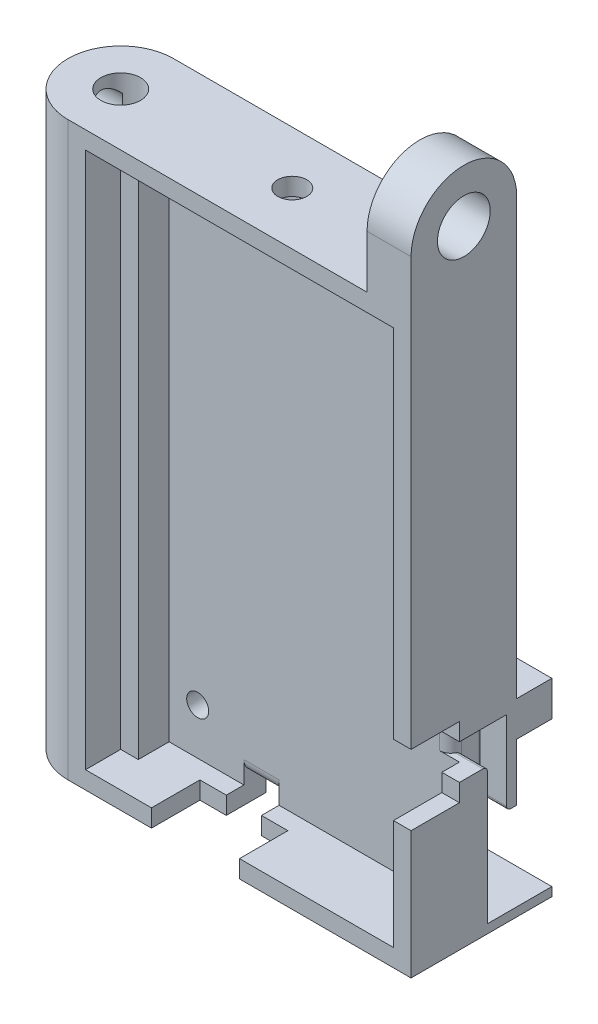
from build123d import *

# Parameters (mm, degrees)
SKETCH1_W                = 39
SKETCH1_H                = 65
BASE_DEPTH               = 4.5
SKETCH2_W                = 4
SKETCH2_H                = 57
WALLS_DEPTH              = 7.5
SKETCH3_W                = 10
SKETCH3_H                = 7.5
PWR_CONNECTOR_HOLE_DEPTH = 4
SKETCH4_W                = 7.5
SKETCH4_H                = 8
GPS_CONNECTOR_HOLE_DEPTH = 4
SKETCH5_R                = 1.25
MOUNTING_HOLES_DEPTH     = 4
GPS_MOUNT_DEPTH          = 4
SKETCH11_W               = 17
SKETCH11_H               = 1
SKETCH11_W_2             = 12
SKETCH11_H_2             = 3
PWR_CABLE_HOLDER1_DEPTH  = 4
SKETCH12_W               = 4
SKETCH12_H               = 2.5
PWR_CABLE_HOLDER2_DEPTH  = 3
PWR_FILLET_R             = 1.5
PWR_FILLET2_R            = 1
PWR_FILLET3_R            = 0.5
GPS_CABLE_HOLDER_DEPTH   = 3
GPS_START                = 1
GPS_FILLET_DEPTH         = 10
GPS_START_2              = 16.5
GPS_FILLET_2_DEPTH       = 4
GPS_START_3              = 9.15727
GPS_FILLET_3_DEPTH       = 8.34273
GPS_FILLET2_R            = 0.5
SKETCH15_R               = 6
BALLON_MOUNT_DEPTH       = 65
SKETCH16_R               = 2.25
BALLOON_MOUNT_HOLE_DEPTH = 65
SKETCH21_R               = 2.25
SAFETY_MOUNT_DEPTH       = 4.5
SKETCH22_W               = 35
SKETCH22_H               = 61
LID_HOLE_DEPTH           = 7.5
SKETCH25_W               = 3.5
SKETCH25_H               = 61
CORRECTION_DEPTH         = 2
SKETCH28_W               = 2
SKETCH28_H               = 2
SKETCH28_W_2             = 3
SMALL_WALLS_DEPTH        = 2
ANTENNA_MOUNTING_DEPTH   = 5
SKETCH30_R               = 3
ANTENNA_HOLE_DEPTH       = 5
SKETCH31_R               = 1.65
CABLE_HOLE_DEPTH         = 2


with BuildPart() as part:
    # Sketch1 → Base (new body)
    with BuildSketch(Plane.XY):
        with Locations((19.5, 32.5)):
            Rectangle(SKETCH1_W, SKETCH1_H)
    extrude(amount=BASE_DEPTH)

    # Sketch2 → Walls (add)
    with BuildSketch(Plane.XY.offset(4.5)):
        Polygon((39, 61), (39, 65), (0, 65), (0, 61), (4, 61), (35, 61), align=None)
        with Locations((37, 32.5)):
            Rectangle(SKETCH2_W, SKETCH2_H)
        Polygon((4, 61), (0, 61), (0, 0), (4, 0), (4, 4), align=None)
        Polygon((39, 0), (39, 4), (35, 4), (4, 4), (4, 0), align=None)
    extrude(amount=WALLS_DEPTH)

    # Sketch3 → PWR connector hole (cut)
    with BuildSketch(Plane(origin=(0, 4, 0), x_dir=(1, 0, 0), z_dir=(0, 1, 0))):
        with Locations((14.5, -8.25)):
            Rectangle(SKETCH3_W, SKETCH3_H)
    extrude(amount=-PWR_CONNECTOR_HOLE_DEPTH, mode=Mode.SUBTRACT)

    # Sketch4 → GPS connector hole (cut)
    with BuildSketch(Plane.ZY.offset(-35)):
        with Locations((8.25, 18.5)):
            Rectangle(SKETCH4_W, SKETCH4_H)
    extrude(amount=-GPS_CONNECTOR_HOLE_DEPTH, mode=Mode.SUBTRACT)

    # Sketch5 → Mounting holes (cut)
    with BuildSketch(Plane.XY.offset(4.5)):
        with Locations((7.25, 7.25)):
            Circle(SKETCH5_R)
        with Locations(Location((31.75, 7.25, 0), (0, 0, 180))):
            Circle(SKETCH5_R)
        with Locations(Location((7.25, 57.75, 0), (0, 0, 180))):
            Circle(SKETCH5_R)
        with Locations((31.75, 57.75)):
            Circle(SKETCH5_R)
    extrude(amount=-MOUNTING_HOLES_DEPTH, mode=Mode.SUBTRACT)

    # Sketch7 → GPS mount (add)
    with BuildSketch(Plane(origin=(0, 0, 0), x_dir=(-1, 0, 0), z_dir=(0, 0, -1))):
        Polygon((-39, 1), (-39, 0), (-7, 0), (-7, 18.5), (-39, 18.5), (-39, 17.5), (-8, 17.5), (-8, 1), align=None)
    extrude(amount=GPS_MOUNT_DEPTH)

    # Sketch11 → PWR cable holder1 (add)
    with BuildSketch(Plane(origin=(0, 0, 0), x_dir=(-1, 0, 0), z_dir=(0, 0, -1))):
        Polygon((-5, 0), (-4, 0), (-4, 21.5), (-5, 21.5), (-5, 20.5), align=None)
        with Locations((-13.5, 21)):
            Rectangle(SKETCH11_W, SKETCH11_H)
        with Locations((-33, 20)):
            Rectangle(SKETCH11_W_2, SKETCH11_H_2)
    extrude(amount=PWR_CABLE_HOLDER1_DEPTH)

    # Sketch12 → PWR cable holder2 (cut)
    with BuildSketch(Plane.XZ):
        Polygon((5, 2), (5, 0), (7, 0), (16.5, 0), (16.5, 2), (12.5, 2), align=None)
        with Locations((14.5, 3.25)):
            Rectangle(SKETCH12_W, SKETCH12_H)
    extrude(amount=-PWR_CABLE_HOLDER2_DEPTH, mode=Mode.SUBTRACT)

    # PWR fillet
    pwr_fillet_edges = [part.edges().sort_by_distance(p)[0] for p in [
        (6, 3, 0),
        (14.5, 3, 4.5),
    ]]
    fillet(pwr_fillet_edges, radius=PWR_FILLET_R)

    # PWR fillet2
    pwr_fillet2_edges = [part.edges().sort_by_distance(p)[0] for p in [
        (27, 21.5, -2),
    ]]
    fillet(pwr_fillet2_edges, radius=PWR_FILLET2_R)

    # PWR fillet3
    pwr_fillet3_edges = [part.edges().sort_by_distance(p)[0] for p in [
        (22, 21.5, -2),
        (22, 20.5, -2),
    ]]
    fillet(pwr_fillet3_edges, radius=PWR_FILLET3_R - 0.0001)  # a hair under: the kernel refuses the full size

    # Sketch13 → GPS cable holder (cut)
    with BuildSketch(Plane(origin=(39, 0, 0), x_dir=(0, 0, -1), z_dir=(1, 0, 0))):
        Polygon((-1.156586719, 11), (-2.326586719, 11), (-2.326586719, 1), (0, 1), (0, 11), align=None)
        Polygon((-2.326586719, 11), (-2.326586719, 16.5), (-3.326586719, 16.5), (-3.326586719, 1), (-2.326586719, 1), align=None)
        Polygon((-1.156586719, 20.5), (-2.326586719, 20.5), (-2.326586719, 16.5), (-2.326586719, 11), (-1.156586719, 11), align=None)
        Polygon((-2.326586719, 20.5), (-4.5, 20.5), (-4.5, 16.5), (-3.326586719, 16.5), (-2.326586719, 16.5), align=None)
    extrude(amount=-GPS_CABLE_HOLDER_DEPTH, mode=Mode.SUBTRACT)

    # GPS fillet: read off the stored shape, not the designer's step
    # GPS fillet outline → GPS fillet (cut)
    with BuildSketch(Plane(origin=(0, 0, 0), x_dir=(1, 0, 0), z_dir=(0, 1, 0)).offset(GPS_START)):
        with BuildLine():
            Line((36, -3.326586719), (36, -3.25))
            ThreePointArc((36, -3.25), (35.999412758, -3.288311358), (35.997651584, -3.326586719))
            Line((35.997651584, -3.326586719), (36, -3.326586719))
        make_face()
        with BuildLine():
            Line((36, -1.25), (36, 0))
            Line((36, 0), (34.75, 0))
            ThreePointArc((34.75, 0), (35.633883476, -0.366116524), (36, -1.25))
        make_face()
    extrude(amount=GPS_FILLET_DEPTH, mode=Mode.SUBTRACT)

    # GPS fillet 2 outline → GPS fillet 2 (cut)
    with BuildSketch(Plane(origin=(0, 0, 0), x_dir=(1, 0, 0), z_dir=(0, 1, 0)).offset(GPS_START_2)):
        with BuildLine():
            ThreePointArc((36, -3.25), (35.633883476, -4.133883476), (34.75, -4.5))
            Line((34.75, -4.5), (36, -4.5))
            Line((36, -4.5), (36, -3.25))
        make_face()
        with BuildLine():
            ThreePointArc((35.996504697, -1.156586719), (35.999125868, -1.203260674), (36, -1.25))
            Line((36, -1.25), (36, -1.156586719))
            Line((36, -1.156586719), (35.996504697, -1.156586719))
        make_face()
    extrude(amount=GPS_FILLET_2_DEPTH, mode=Mode.SUBTRACT)

    # GPS fillet 3 outline → GPS fillet 3 (cut)
    with BuildSketch(Plane(origin=(0, 0, 0), x_dir=(1, 0, 0), z_dir=(0, 1, 0)).offset(GPS_START_3)):
        with BuildLine():
            Line((36, -3.326586719), (36, -3.25))
            ThreePointArc((36, -3.25), (35.999412758, -3.288311358), (35.997651584, -3.326586719))
            Line((35.997651584, -3.326586719), (36, -3.326586719))
        make_face()
        with BuildLine():
            ThreePointArc((35.996504697, -1.156586719), (35.999125868, -1.203260674), (36, -1.25))
            Line((36, -1.25), (36, -1.156586719))
            Line((36, -1.156586719), (35.996504697, -1.156586719))
        make_face()
    extrude(amount=GPS_FILLET_3_DEPTH, mode=Mode.SUBTRACT)

    # GPS fillet2
    # the kernel refuses this fillet: 0.5 mm, written as the material it takes off along each edge
    with BuildSketch(Plane(origin=(40.25, 11, 1.156586719), x_dir=(0, 0, -1), z_dir=(-1, 0, 0))) as gps_fillet2_piece_1:
        with BuildLine():
            CenterArc((GPS_FILLET2_R, -GPS_FILLET2_R), GPS_FILLET2_R, 90, 90)
            Line((0, -GPS_FILLET2_R), (0, 0))
            Line((0, 0), (GPS_FILLET2_R, 0))
        make_face()
    extrude(amount=4.25, mode=Mode.SUBTRACT)
    with BuildSketch(Plane(origin=(40.25, 16.5, 3.326586719), x_dir=(0, -1, 0), z_dir=(-1, 0, 0))) as gps_fillet2_piece_2:
        with BuildLine():
            CenterArc((GPS_FILLET2_R, GPS_FILLET2_R), GPS_FILLET2_R, 180, 90)
            Line((0, GPS_FILLET2_R), (0, 0))
            Line((0, 0), (GPS_FILLET2_R, 0))
        make_face()
    extrude(amount=4.25, mode=Mode.SUBTRACT)
    with BuildSketch(Plane(origin=(36, 16.5, 3.326586719), x_dir=(0, -1.0, 5.126796764898245e-10), z_dir=(-1, 0, 0))) as gps_fillet2_piece_3_section:
        with BuildLine():
            CenterArc((GPS_FILLET2_R, GPS_FILLET2_R), GPS_FILLET2_R, 179.999999971, 90)
            Line((GPS_FILLET2_R * 5.12679676753e-10, GPS_FILLET2_R), (0, 0))
            Line((0, 0), (GPS_FILLET2_R, 0))
        make_face()
    gps_fillet2_piece_3 = extrude(amount=1.252348417, mode=Mode.PRIVATE)
    gps_fillet2_piece_3 = gps_fillet2_piece_3 - Plane(origin=(34.749999755, 16.5, 3.249999996), x_dir=(1.0, 0, 2.949740140725451e-09), z_dir=(0, -1, 0)) * Cylinder(1.250000245, 5, mode=Mode.PRIVATE)
    add(gps_fillet2_piece_3, mode=Mode.SUBTRACT)
    with BuildSketch(Plane(origin=(34.746504697, 11, 1.156586719), x_dir=(0, 0, -1), z_dir=(1, 0, 0))) as gps_fillet2_piece_4_section:
        with BuildLine():
            CenterArc((GPS_FILLET2_R, GPS_FILLET2_R), GPS_FILLET2_R, 180, 90)
            Line((-GPS_FILLET2_R * 5.12674791509e-10, GPS_FILLET2_R), (0, 0))
            Line((0, 0), (GPS_FILLET2_R, 0))
        make_face()
    gps_fillet2_piece_4 = extrude(amount=1.253495303, mode=Mode.PRIVATE)
    gps_fillet2_piece_4 = gps_fillet2_piece_4 - Plane(origin=(34.749999998, 11, 1.250000002), x_dir=(1.3197563913171698e-09, 0, -1.0), z_dir=(0, -1, 0)) * Cylinder(1.250000002, 5, mode=Mode.PRIVATE)
    add(gps_fillet2_piece_4, mode=Mode.SUBTRACT)

    # Sketch15 → Ballon mount (add)
    with BuildSketch(Plane.XZ):
        with Locations((0, 6)):
            Circle(SKETCH15_R)
    extrude(amount=-BALLON_MOUNT_DEPTH)

    # Sketch16 → Balloon mount hole (cut)
    with BuildSketch(Plane.XZ):
        with Locations(Location((0, 6, 0), (0, 0, 270))):
            Circle(SKETCH16_R)
    extrude(amount=-BALLOON_MOUNT_HOLE_DEPTH, mode=Mode.SUBTRACT)

    # Sketch21 → Safety mount (cut)
    with BuildSketch(Plane.ZY.offset(6)):
        with Locations((6, 3.5)):
            Circle(SKETCH21_R)
        with Locations((6, 61.5)):
            Circle(SKETCH21_R)
    extrude(amount=-SAFETY_MOUNT_DEPTH, mode=Mode.SUBTRACT)

    # Sketch22 → Lid hole (cut)
    with BuildSketch(Plane.XY.offset(12)):
        with Locations((19.5, 32.5)):
            Rectangle(SKETCH22_W, SKETCH22_H)
    extrude(amount=-LID_HOLE_DEPTH, mode=Mode.SUBTRACT)

    # Sketch25 → Correction (add)
    with BuildSketch(Plane(origin=(2, 0, 0), x_dir=(0, 0, -1), z_dir=(1, 0, 0))):
        with Locations((-6.25, 32.5)):
            Rectangle(SKETCH25_W, SKETCH25_H)
    extrude(amount=CORRECTION_DEPTH)

    # Sketch28 → Small walls (add)
    with BuildSketch(Plane.XY.offset(4.5)):
        with Locations((38, 21.5)):
            Rectangle(SKETCH28_W, SKETCH28_H)
        with Locations((38, 15.5)):
            Rectangle(SKETCH28_W, SKETCH28_H)
        with Locations((18, 1)):
            Rectangle(SKETCH28_W_2, SKETCH28_H)
        with Locations((11, 1)):
            Rectangle(SKETCH28_W_2, SKETCH28_H)
    extrude(amount=SMALL_WALLS_DEPTH)

    # Sketch29 → Antenna mounting (add)
    with BuildSketch(Plane(origin=(39, 0, 0), x_dir=(0, 0, -1), z_dir=(1, 0, 0))):
        with BuildLine():
            Line((0, 65), (0, 71))
            ThreePointArc((0, 71), (-6, 77), (-12, 71))
            Line((-12, 71), (-12, 65))
            Line((-12, 65), (0, 65))
        make_face()
    extrude(amount=-ANTENNA_MOUNTING_DEPTH)

    # Sketch30 → Antenna hole (cut)
    with BuildSketch(Plane(origin=(39, 0, 0), x_dir=(0, 0, -1), z_dir=(1, 0, 0))):
        with Locations((-6, 71)):
            Circle(SKETCH30_R)
    extrude(amount=-ANTENNA_HOLE_DEPTH, mode=Mode.SUBTRACT)

    # Sketch31 → Cable hole (cut)
    with BuildSketch(Plane(origin=(0, 65, 0), x_dir=(1, 0, 0), z_dir=(0, 1, 0))):
        with Locations(Location((19.5, -6, 0), (0, 0, 270))):
            Circle(SKETCH31_R)
    extrude(amount=-CABLE_HOLE_DEPTH, mode=Mode.SUBTRACT)


solid = part.part
